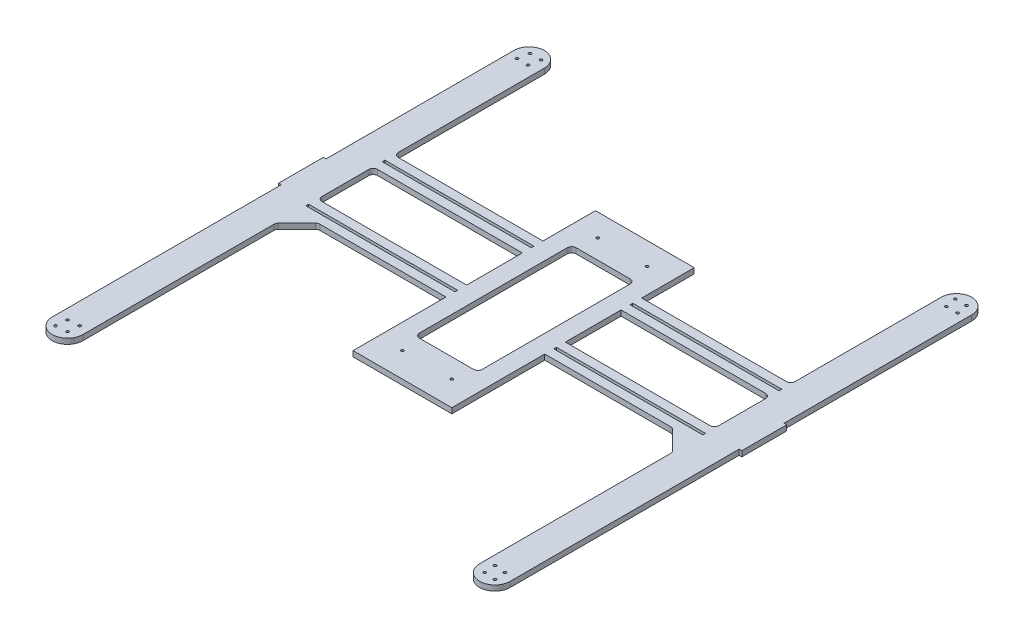
from build123d import *

# Parameters (mm, degrees)
SKETCH1_R           = 1.5
SKETCH1_W           = 166
SKETCH1_H           = 3
SKETCH1_H_2         = 62
SKETCH1_W_2         = 70
SKETCH1_H_3         = 174.5
BOSS_EXTRUDE1_DEPTH = 6
FILLET_1_R          = 5


with BuildPart() as part:
    # Sketch1 → Boss-Extrude1 (new body)
    with BuildSketch(Plane(origin=(0, 0, 0), x_dir=(1, 0, 0), z_dir=(0, 1, 0))):
        with BuildLine():
            Line((192.5, -16.5), (216, -40))
            Line((216, -40), (216, -255))
            ThreePointArc((216, -255), (233, -272), (250, -255))
            Line((250, -255), (250, 0))
            Line((250, 0), (253, 0))
            Line((253, 0), (253, 50))
            Line((253, 50), (250, 50))
            Line((250, 50), (250, 259.060301809))
            ThreePointArc((250, 259.060301809), (233, 276.060301809), (216, 259.060301809))
            Line((216, 259.060301809), (216, 91.5))
            Line((216, 91.5), (50, 91.5))
            Line((50, 91.5), (50, 150))
            Line((50, 150), (-60, 150))
            Line((-60, 150), (-60, 91.5))
            Line((-60, 91.5), (-226, 91.5))
            Line((-226, 91.5), (-226, 259.060301809))
            ThreePointArc((-226, 259.060301809), (-243, 276.060301809), (-260, 259.060301809))
            Line((-260, 259.060301809), (-260, 50))
            Line((-260, 50), (-263, 50))
            Line((-263, 50), (-263, 0))
            Line((-263, 0), (-260, 0))
            Line((-260, 0), (-260, -255))
            ThreePointArc((-260, -255), (-243, -272), (-226, -255))
            Line((-226, -255), (-226, -40))
            Line((-226, -40), (-202.5, -16.5))
            Line((-202.5, -16.5), (-60, -16.5))
            Line((-60, -16.5), (-60, -120))
            Line((-60, -120), (50, -120))
            Line((50, -120), (50, -16.5))
            Line((50, -16.5), (192.5, -16.5))
        make_face()
        with Locations((-249.717514421, -261.717514421)):
            Circle(SKETCH1_R, mode=Mode.SUBTRACT)
        with Locations((-237.343145751, -260.656854249)):
            Circle(SKETCH1_R, mode=Mode.SUBTRACT)
        with Locations((-248.656854249, -249.343145751)):
            Circle(SKETCH1_R, mode=Mode.SUBTRACT)
        with Locations((-236.282485579, -248.282485579)):
            Circle(SKETCH1_R, mode=Mode.SUBTRACT)
        with Locations((-143, -5)):
            Rectangle(SKETCH1_W, SKETCH1_H, mode=Mode.SUBTRACT)
        with Locations((-32.5, -92.5)):
            Circle(SKETCH1_R, mode=Mode.SUBTRACT)
        with Locations((227.343145751, -260.656854249)):
            Circle(SKETCH1_R, mode=Mode.SUBTRACT)
        with Locations((239.717514421, -261.717514421)):
            Circle(SKETCH1_R, mode=Mode.SUBTRACT)
        with Locations((226.282485579, -248.282485579)):
            Circle(SKETCH1_R, mode=Mode.SUBTRACT)
        with Locations((238.656854249, -249.343145751)):
            Circle(SKETCH1_R, mode=Mode.SUBTRACT)
        with Locations((22.5, -92.5)):
            Circle(SKETCH1_R, mode=Mode.SUBTRACT)
        with Locations((133, -5)):
            Rectangle(SKETCH1_W, SKETCH1_H, mode=Mode.SUBTRACT)
        with Locations((-143, 37.5)):
            Rectangle(SKETCH1_W, SKETCH1_H_2, mode=Mode.SUBTRACT)
        with Locations((-143, 80)):
            Rectangle(SKETCH1_W, SKETCH1_H, mode=Mode.SUBTRACT)
        with Locations((-32.5, 125)):
            Circle(SKETCH1_R, mode=Mode.SUBTRACT)
        with Locations((-250.326962678, 253.013350683)):
            Circle(SKETCH1_R, mode=Mode.SUBTRACT)
        with Locations((-237.907830631, 252.890227975)):
            Circle(SKETCH1_R, mode=Mode.SUBTRACT)
        with Locations((-248.092169369, 265.230375643)):
            Circle(SKETCH1_R, mode=Mode.SUBTRACT)
        with Locations((-235.673037322, 265.107252935)):
            Circle(SKETCH1_R, mode=Mode.SUBTRACT)
        with Locations((-5, 16.25)):
            Rectangle(SKETCH1_W_2, SKETCH1_H_3, mode=Mode.SUBTRACT)
        with Locations((22.5, 125)):
            Circle(SKETCH1_R, mode=Mode.SUBTRACT)
        with Locations((133, 37.5)):
            Rectangle(SKETCH1_W, SKETCH1_H_2, mode=Mode.SUBTRACT)
        with Locations((133, 80)):
            Rectangle(SKETCH1_W, SKETCH1_H, mode=Mode.SUBTRACT)
        with Locations((227.907830631, 252.890227975)):
            Circle(SKETCH1_R, mode=Mode.SUBTRACT)
        with Locations((240.326962678, 253.013350683)):
            Circle(SKETCH1_R, mode=Mode.SUBTRACT)
        with Locations((225.673037322, 265.107252935)):
            Circle(SKETCH1_R, mode=Mode.SUBTRACT)
        with Locations((238.092169369, 265.230375643)):
            Circle(SKETCH1_R, mode=Mode.SUBTRACT)
    extrude(amount=BOSS_EXTRUDE1_DEPTH)

    # Скругление1
    fillet_1_edges = [part.edges().sort_by_distance(p)[0] for p in [
        (216, 3, -6.5),
        (216, 3, -68.5),
        (216, 3, -91.5),
        (-226, 3, -6.5),
        (-226, 3, -68.5),
        (-226, 3, -91.5),
        (-226, 3, 40),
        (-202.5, 3, 16.5),
        (216, 3, 40),
        (192.5, 3, 16.5),
        (-40, 3, 71),
        (30, 3, 71),
        (30, 3, -103.5),
        (-40, 3, -103.5),
    ]]
    fillet(fillet_1_edges, radius=FILLET_1_R)


solid = part.part
